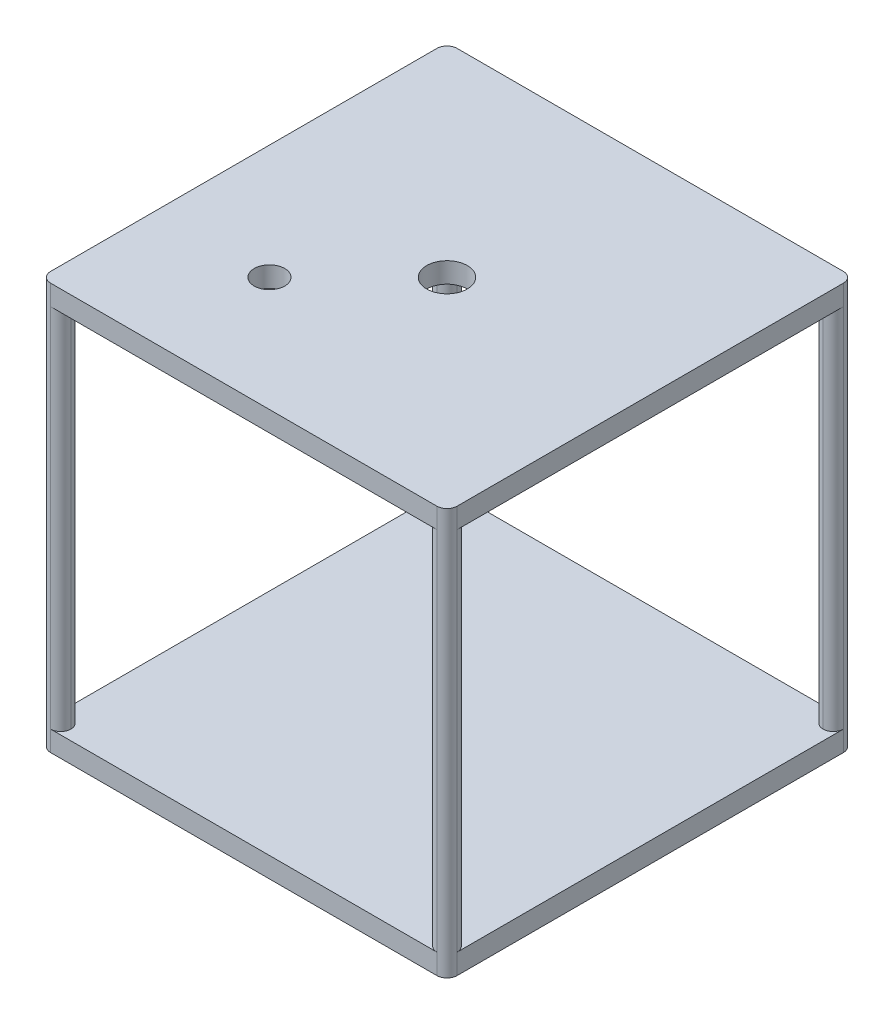
from build123d import *

# Parameters (mm, degrees)
SKETCH2_W           = 400
SKETCH2_H           = 400
BOSS_EXTRUDE1_DEPTH = 400
SKETCH3_W           = 360
SKETCH3_H           = 360
CUT_EXTRUDE4_DEPTH  = 400
SKETCH5_W           = 360
SKETCH5_H           = 360
CUT_EXTRUDE5_DEPTH  = 400
FILLET1_R           = 10
FILLET2_START       = -1
FILLET2_DEPTH       = 402
FILLET3_R           = 10
FILLET4_R           = 10
FILLET6_R           = 10
FILLET7_R           = 10
FILLET8_R           = 10
SKETCH6_R           = 20
CUT_EXTRUDE6_DEPTH  = 20
SKETCH9_R           = 15
CUT_EXTRUDE8_DEPTH  = 71


with BuildPart() as part:
    # Sketch2 → Boss-Extrude1 (new body)
    with BuildSketch(Plane(origin=(0, 0, 0), x_dir=(1, 0, 0), z_dir=(0, 1, 0))):
        Rectangle(SKETCH2_W, SKETCH2_H)
    extrude(amount=BOSS_EXTRUDE1_DEPTH)

    # Sketch3 → Cut-Extrude4 (cut)
    with BuildSketch(Plane.XY.offset(200)):
        with Locations((0, 200)):
            Rectangle(SKETCH3_W, SKETCH3_H)
    extrude(amount=-CUT_EXTRUDE4_DEPTH, mode=Mode.SUBTRACT)

    # Sketch5 → Cut-Extrude5 (cut)
    with BuildSketch(Plane.ZY.offset(200)):
        with Locations((0, 200)):
            Rectangle(SKETCH5_W, SKETCH5_H)
    extrude(amount=-CUT_EXTRUDE5_DEPTH, mode=Mode.SUBTRACT)

    # Fillet1
    fillet1_edges = [part.edges().sort_by_distance(p)[0] for p in [
        (200, 200, 180),
    ]]
    fillet(fillet1_edges, radius=FILLET1_R)

    # Fillet2: read off the stored shape, not the designer's step
    # Fillet2 outline → Fillet2 (cut)
    with BuildSketch(Plane(origin=(0, 0, 0), x_dir=(1, 0, 0), z_dir=(0, 1, 0)).offset(FILLET2_START)):
        with BuildLine():
            Line((200, -200), (200, -190))
            ThreePointArc((200, -190), (197.071067812, -197.071067812), (190, -200))
            Line((190, -200), (200, -200))
        make_face()
    extrude(amount=FILLET2_DEPTH, mode=Mode.SUBTRACT)

    # Fillet3
    fillet3_edges = [part.edges().sort_by_distance(p)[0] for p in [
        (180, 200, 180),
    ]]
    fillet(fillet3_edges, radius=FILLET3_R - 0.0001)  # a hair under: the kernel refuses the full size

    # Fillet4
    fillet4_edges = [part.edges().sort_by_distance(p)[0] for p in [
        (180, 200, 200),
    ]]
    fillet(fillet4_edges, radius=FILLET4_R - 0.0001)  # a hair under: the kernel refuses the full size

    # Fillet6
    fillet6_edges = [part.edges().sort_by_distance(p)[0] for p in [
        (-180, 200, -180),
        (-180, 200, -200),
        (-200, 200, -200),
        (-200, 200, -180),
    ]]
    fillet(fillet6_edges, radius=FILLET6_R - 0.0001)  # a hair under: the kernel refuses the full size

    # Fillet7
    fillet7_edges = [part.edges().sort_by_distance(p)[0] for p in [
        (200, 200, -180),
        (180, 200, -180),
        (180, 200, -200),
        (200, 200, -200),
    ]]
    fillet(fillet7_edges, radius=FILLET7_R - 0.0001)  # a hair under: the kernel refuses the full size

    # Fillet8
    fillet8_edges = [part.edges().sort_by_distance(p)[0] for p in [
        (-180, 200, 180),
        (-200, 200, 180),
        (-180, 200, 200),
        (-200, 200, 200),
    ]]
    fillet(fillet8_edges, radius=FILLET8_R - 0.0001)  # a hair under: the kernel refuses the full size

    # Sketch6 → Cut-Extrude6 (cut)
    with BuildSketch(Plane(origin=(0, 400, 0), x_dir=(1, 0, 0), z_dir=(0, 1, 0))):
        with Locations(Location((0, 0, 0), (0, 0, 270))):
            Circle(SKETCH6_R)
    extrude(amount=-CUT_EXTRUDE6_DEPTH, mode=Mode.SUBTRACT)

    # Sketch9 → Cut-Extrude8 (cut)
    with BuildSketch(Plane(origin=(0, 400, 0), x_dir=(1, 0, 0), z_dir=(0, 1, 0))):
        with Locations(Location((-87.327687477, -87.327687477, 0), (0, 0, 270))):
            Circle(SKETCH9_R)
    extrude(amount=-CUT_EXTRUDE8_DEPTH, mode=Mode.SUBTRACT)


solid = part.part
